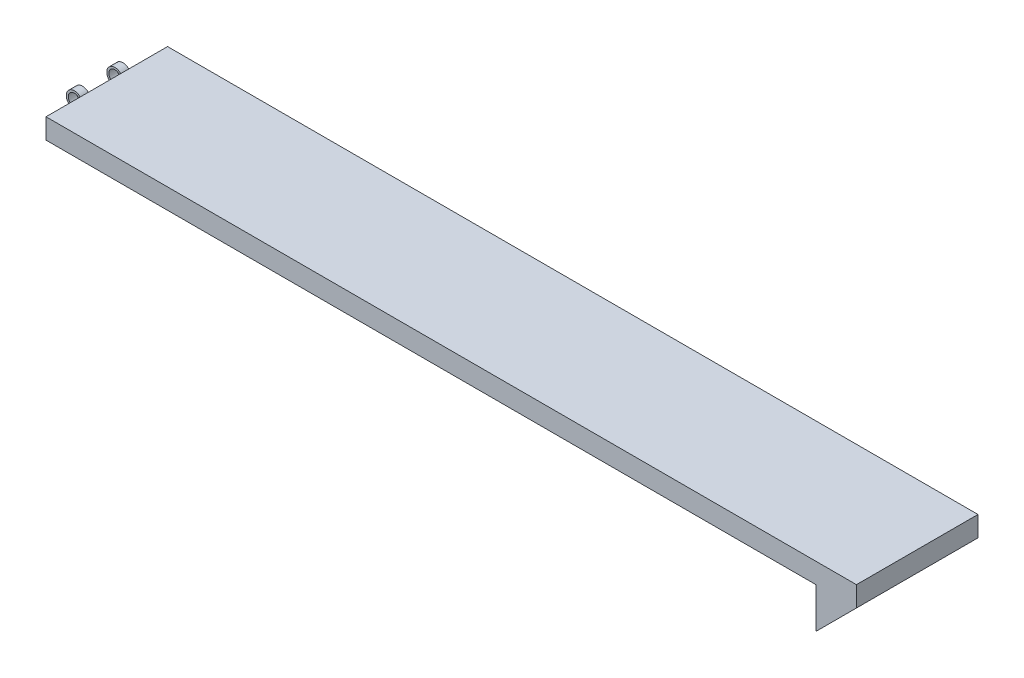
from build123d import *

# Parameters (mm, degrees)
SKETCH1_W           = 254
SKETCH1_H           = 38.1
BOSS_EXTRUDE1_DEPTH = 6.35
SKETCH2_R           = 2.54
SKETCH2_R_2         = 1.905
BOSS_EXTRUDE2_DEPTH = 1.27
LPATTERN1_COUNT     = 2
LPATTERN1_PITCH     = 12.7
SKETCH5_W           = 12.7
SKETCH5_H           = 38.1
BOSS_EXTRUDE3_DEPTH = 12.7
CHAMFER1_SIZE       = 12.7


with BuildPart() as part:
    # Sketch1 → Boss-Extrude1 (new body)
    with BuildSketch(Plane(origin=(0, 0, 0), x_dir=(1, 0, 0), z_dir=(0, 1, 0))):
        with Locations((127, 19.05)):
            Rectangle(SKETCH1_W, SKETCH1_H)
    extrude(amount=BOSS_EXTRUDE1_DEPTH)

    # Sketch5 → Boss-Extrude3 (add)
    with BuildSketch(Plane.XZ):
        with Locations((247.65, -19.05)):
            Rectangle(SKETCH5_W, SKETCH5_H)
    extrude(amount=BOSS_EXTRUDE3_DEPTH)

    # Chamfer1
    chamfer1_edges = [part.edges().sort_by_distance(p)[0] for p in [
        (254, -12.7, -19.05),
    ]]
    chamfer(chamfer1_edges, length=CHAMFER1_SIZE - 0.0001)  # a hair under: the kernel refuses the full size


with BuildPart() as body_2:
    # Sketch2 → Boss-Extrude2 (new, symmetric)
    with BuildSketch(Plane.XY.offset(-12.7)):
        with Locations((-2.54, 3.872789775)):
            Circle(SKETCH2_R)
        with Locations((-2.54, 3.872789775)):
            Circle(SKETCH2_R_2, mode=Mode.SUBTRACT)
    boss_extrude2 = extrude(amount=BOSS_EXTRUDE2_DEPTH, both=True)


with BuildPart() as lpattern1_1:
    # LPattern1: Boss-Extrude2 ×2
    with Locations(*[(0, 0, -i * LPATTERN1_PITCH) for i in range(1, LPATTERN1_COUNT)]):
        add(boss_extrude2)


solid = Compound([part.part, body_2.part, lpattern1_1.part])
